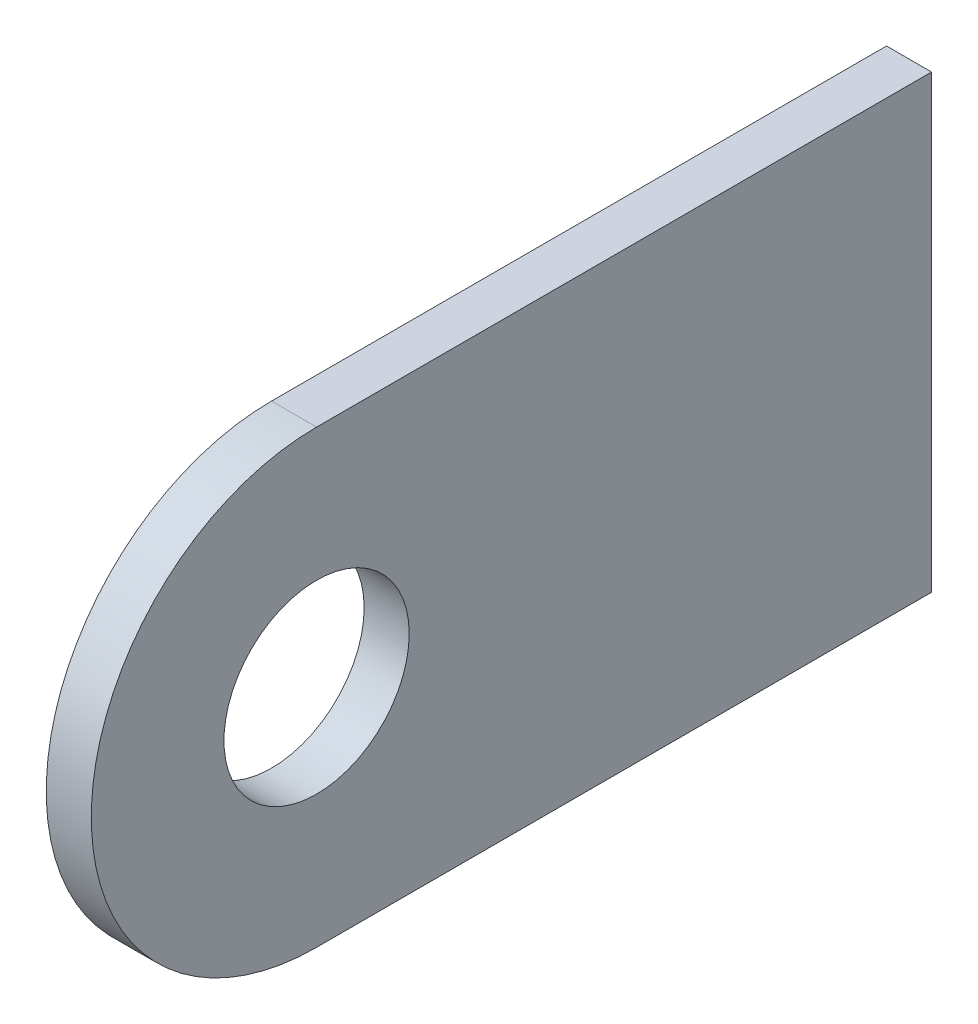
from build123d import *

# Parameters (mm, degrees)
BOSS_EXTRUDE1_DEPTH     = 1.5875
F_1_4_CLEARANCE_HOLE1_D = 6.5278


with BuildPart() as part:
    # Sketch1 → Boss-Extrude1 (new body)
    with BuildSketch(Plane(origin=(0, 0, 0), x_dir=(0, 0, -1), z_dir=(1, 0, 0))):
        with BuildLine():
            Line((3.175, -7.9375), (3.175, 7.9375))
            Line((3.175, 7.9375), (-18.49374, 7.9375))
            ThreePointArc((-18.49374, 7.9375), (-26.43124, 0), (-18.49374, -7.9375))
            Line((-18.49374, -7.9375), (3.175, -7.9375))
        make_face()
    extrude(amount=BOSS_EXTRUDE1_DEPTH)

    # 1/4 Clearance Hole1 (through all)
    with Locations(Plane(origin=(1.5875, 0, 0), x_dir=(0, 0, -1), z_dir=(1, 0, 0))):
        with Locations((-18.49374, 0)):
            Hole(F_1_4_CLEARANCE_HOLE1_D / 2)


solid = part.part
